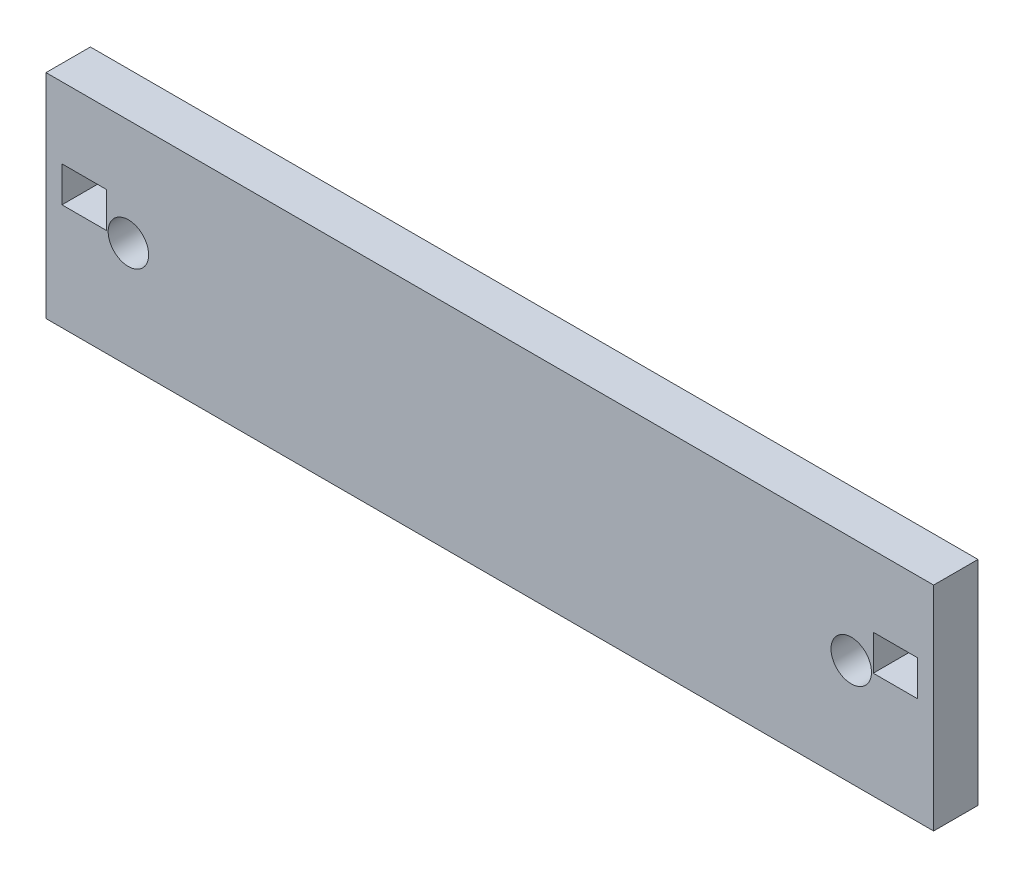
from build123d import *

# Parameters (mm, degrees)
SKETCH1_W           = 31.75
SKETCH1_H           = 7.62
SKETCH1_R           = 0.7239
SKETCH1_W_2         = 1.5875
SKETCH1_H_2         = 1.27
BOSS_EXTRUDE1_DEPTH = 1.5875


with BuildPart() as part:
    # Sketch1 → Boss-Extrude1 (new body)
    with BuildSketch(Plane.XY):
        Rectangle(SKETCH1_W, SKETCH1_H)
        with Locations((-12.9286, 0)):
            Circle(SKETCH1_R, mode=Mode.SUBTRACT)
        with Locations((12.9286, 0)):
            Circle(SKETCH1_R, mode=Mode.SUBTRACT)
        with Locations((-14.50975, 0.635)):
            Rectangle(SKETCH1_W_2, SKETCH1_H_2, mode=Mode.SUBTRACT)
        with Locations((14.50975, 0.635)):
            Rectangle(SKETCH1_W_2, SKETCH1_H_2, mode=Mode.SUBTRACT)
    extrude(amount=BOSS_EXTRUDE1_DEPTH)


solid = part.part
